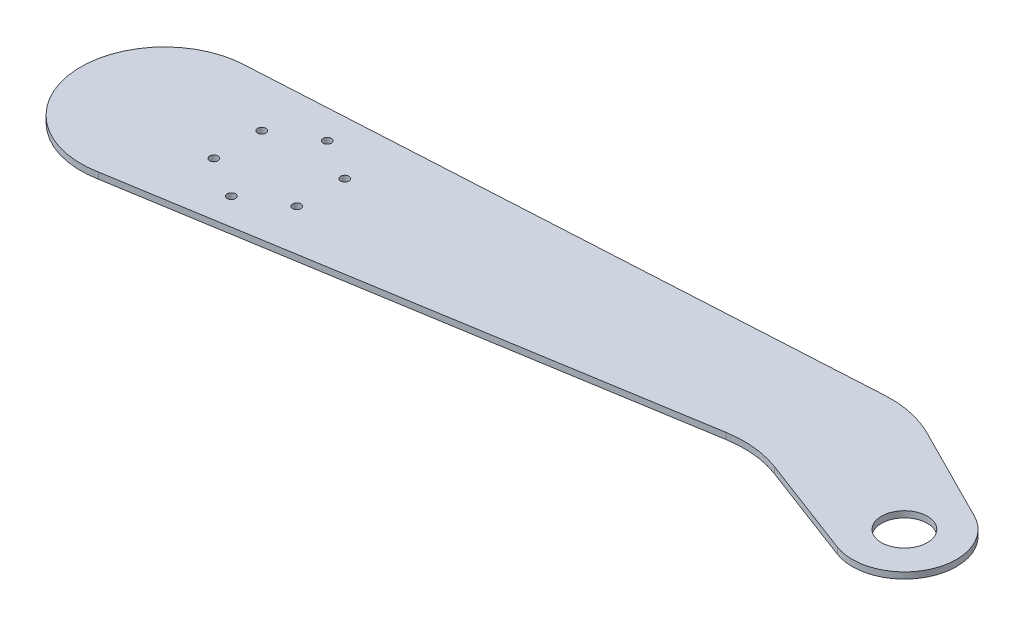
from build123d import *

# Parameters (mm, degrees)
SKETCH1_R           = 2
SKETCH1_R_2         = 11
BOSS_EXTRUDE2_DEPTH = 3
FILLET1_R           = 50


with BuildPart() as part:
    # Sketch1 → Boss-Extrude2 (new body)
    with BuildSketch(Plane(origin=(0, 0, 0), x_dir=(1, 0, 0), z_dir=(0, 1, 0))):
        with BuildLine():
            Line((-42.006467429, -44.881441952), (230.077464987, -0.308197366))
            Line((230.077464987, -0.308197366), (291.16461822, -23.386663481))
            ThreePointArc((291.16461822, -23.386663481), (322.884028765, -10.065844598), (311.267854408, 22.316708024))
            Line((311.267854408, 22.316708024), (252.97547919, 51.748916229))
            Line((252.97547919, 51.748916229), (-50.820768684, 34.708295365))
            ThreePointArc((-50.820768684, 34.708295365), (-89.632507977, -9.872922998), (-42.006467429, -44.881441952))
        make_face()
        with Locations((0, 23)):
            Circle(SKETCH1_R, mode=Mode.SUBTRACT)
        with Locations((0, -23)):
            Circle(SKETCH1_R, mode=Mode.SUBTRACT)
        with Locations((-19.918584287, -11.5)):
            Circle(SKETCH1_R, mode=Mode.SUBTRACT)
        with Locations((19.918584287, -11.5)):
            Circle(SKETCH1_R, mode=Mode.SUBTRACT)
        with Locations((-19.918584287, 11.5)):
            Circle(SKETCH1_R, mode=Mode.SUBTRACT)
        with Locations((19.918584287, 11.5)):
            Circle(SKETCH1_R, mode=Mode.SUBTRACT)
        with Locations((300, 0)):
            Circle(SKETCH1_R_2, mode=Mode.SUBTRACT)
    extrude(amount=BOSS_EXTRUDE2_DEPTH)

    # Fillet1
    fillet1_edges = [part.edges().sort_by_distance(p)[0] for p in [
        (230.077464987, 1.5, 0.308197366),
        (252.97547919, 1.5, -51.748916229),
    ]]
    fillet(fillet1_edges, radius=FILLET1_R)


solid = part.part
